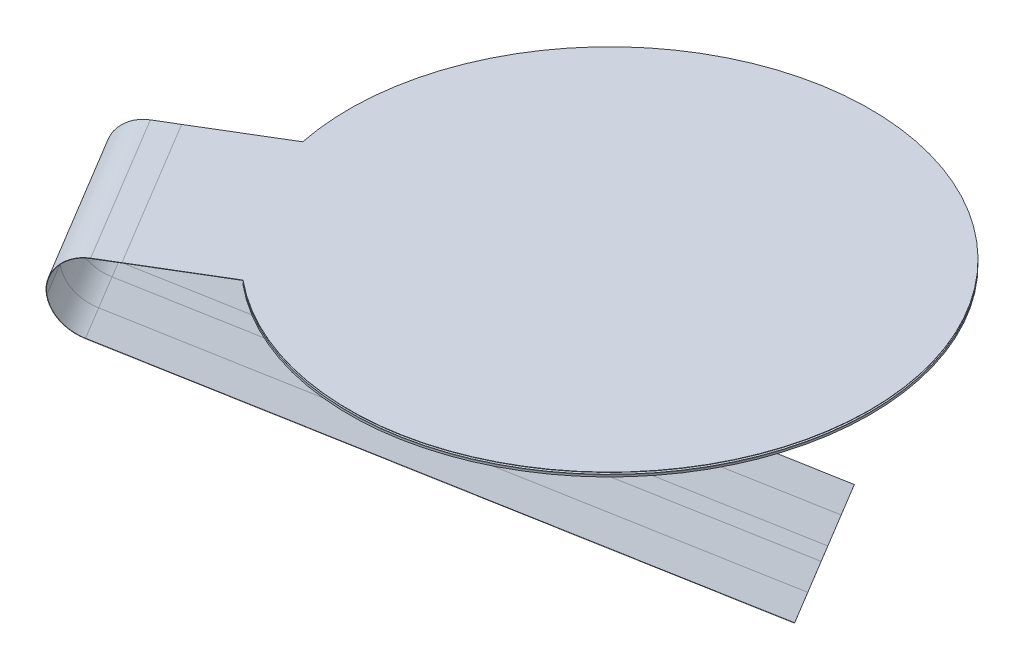
from build123d import *

# Parameters (mm, degrees)
PET_ALL_DEPTH           = 0.01
EXTRUDE_2_DEPTH         = 0.05
EXTRUDE_2_2_DEPTH       = 0.05
EXTRUDE_3_DEPTH         = 0.05
EXTRUDE_5_DEPTH         = 0.05
FSR_START               = -0.06
FSR_DEPTH               = 0.01
EXTRUDE_START           = -0.05
EXTRUDE_3763_DEPTH      = 0.01
EXTRUDE_START_2         = -0.01
EXTRUDE_4177_DEPTH      = 0.11
EXTRUDE_4177_2_DEPTH    = 0.11
PET_TOUCH_START         = -0.07
PET_TOUCH_DEPTH         = 0.05
CUT_EXTRUDE1_DEPTH      = 36.388876363
CUT_EXTRUDE1_DEPTH_BACK = 36.388876363
SKETCH2_W               = 25.467698382
SKETCH2_H               = 11.490233749
SWEEP4_START            = -2.68
SWEEP4_DEPTH            = 5.36


# Read off the part's stored shape, not the designer's step: Sweep4
with BuildPart() as part:
    # 草图1 → PET_all (new body)
    with BuildSketch(Plane(origin=(0, 0, 0), x_dir=(1, 0, 0), z_dir=(0, 1, 0))):
        with BuildLine():
            Line((-5.080806512, -6.179434051), (-26.906218882, -19.293464838))
            Line((-26.906218882, -19.293464838), (-29.666822964, -14.699048106))
            Line((-29.666822964, -14.699048106), (-7.841410594, -1.585017319))
            ThreePointArc((-7.841410594, -1.585017319), (6.857338406, 4.120304599), (-5.080806512, -6.179434051))
        make_face()
    extrude(amount=PET_ALL_DEPTH)


with BuildPart() as body_2:
    # 草图2 → 凸台-拉伸2 (new body)
    with BuildSketch(Plane(origin=(0, 0, 0), x_dir=(1, 0, 0), z_dir=(0, 1, 0))):
        with BuildLine():
            Line((-6.852556619, -2.367481316), (-29.059078036, -15.710505521))
            Line((-29.059078036, -15.710505521), (-28.441032346, -16.739106282))
            Line((-28.441032346, -16.739106282), (-6.020473703, -3.267475537))
            ThreePointArc((-6.020473703, -3.267475537), (-3.952951141, 5.594343328), (5.090542055, 4.583544654))
            Line((5.090542055, 4.583544654), (5.387799985, 4.851196896))
            ThreePointArc((5.387799985, 4.851196896), (-3.682893806, 6.244901378), (-6.852556619, -2.367481316))
        make_face()
    extrude(amount=-EXTRUDE_2_DEPTH)

    # 草图8 → 凸台-拉伸5 (add)
    with BuildSketch(Plane(origin=(0, 0, 0), x_dir=(1, 0, 0), z_dir=(0, 1, 0))):
        with BuildLine():
            Line((1.081454982, 6.892290407), (6.242295753, -1.696791))
            ThreePointArc((6.242295753, -1.696791), (6.20808283, -1.834011537), (6.070862293, -1.799798615))
            Line((6.070862293, -1.799798615), (0.910021522, 6.789282792))
            Line((0.910021522, 6.789282792), (1.081454982, 6.892290407))
        make_face()
        with BuildLine():
            Line((5.763896557, -2.648044658), (0.057038255, 6.849762524))
            Line((0.057038255, 6.849762524), (0.228471715, 6.952770139))
            Line((0.228471715, 6.952770139), (5.935330017, -2.545037043))
            ThreePointArc((5.935330017, -2.545037043), (5.901117095, -2.68225758), (5.763896557, -2.648044658))
        make_face()
        with BuildLine():
            Line((5.383870342, -3.374697643), (-0.735925728, 6.810353392))
            Line((-0.735925728, 6.810353392), (-0.564492268, 6.913361007))
            Line((-0.564492268, 6.913361007), (5.555303802, -3.271690028))
            ThreePointArc((5.555303802, -3.271690028), (5.521090879, -3.408910565), (5.383870342, -3.374697643))
        make_face()
        with BuildLine():
            Line((4.946475675, -4.005873492), (-1.479272302, 6.688367025))
            Line((-1.479272302, 6.688367025), (-1.307838842, 6.79137464))
            Line((-1.307838842, 6.79137464), (5.117909135, -3.902865877))
            ThreePointArc((5.117909135, -3.902865877), (5.083696212, -4.040086414), (4.946475675, -4.005873492))
        make_face()
        with BuildLine():
            Line((4.460485593, -4.556172989), (-2.179199966, 6.494119456))
            Line((-2.179199966, 6.494119456), (-2.007766505, 6.597127071))
            Line((-2.007766505, 6.597127071), (4.631919054, -4.453165374))
            ThreePointArc((4.631919054, -4.453165374), (4.597706131, -4.590385912), (4.460485593, -4.556172989))
        make_face()
        with BuildLine():
            Line((3.930995262, -5.034075912), (-2.839423406, 6.233792964))
            Line((-2.839423406, 6.233792964), (-2.667989946, 6.336800579))
            Line((-2.667989946, 6.336800579), (4.102428722, -4.931068297))
            ThreePointArc((4.102428722, -4.931068297), (4.068215799, -5.068288835), (3.930995262, -5.034075912))
        make_face()
        with BuildLine():
            Line((3.360799138, -5.444233021), (-3.461976024, 5.910771693))
            Line((-3.461976024, 5.910771693), (-3.290542564, 6.013779308))
            Line((-3.290542564, 6.013779308), (3.532232598, -5.341225406))
            ThreePointArc((3.532232598, -5.341225406), (3.498019675, -5.478445944), (3.360799138, -5.444233021))
        make_face()
        with BuildLine():
            Line((2.751005911, -5.788489484), (-4.05547466, 5.539396479))
            Line((-4.05547466, 5.539396479), (-3.8840412, 5.642404094))
            Line((-3.8840412, 5.642404094), (2.922439372, -5.685481869))
            ThreePointArc((2.922439372, -5.685481869), (2.888226449, -5.822702407), (2.751005911, -5.788489484))
        make_face()
        with BuildLine():
            Line((2.10125667, -6.066247971), (-4.6144792, 5.110613445))
            Line((-4.6144792, 5.110613445), (-4.443045739, 5.21362106))
            Line((-4.443045739, 5.21362106), (2.27269013, -5.963240356))
            ThreePointArc((2.27269013, -5.963240356), (2.238477207, -6.100460893), (2.10125667, -6.066247971))
        make_face()
        with BuildLine():
            Line((1.409655834, -6.274353709), (-5.134986189, 4.617759729))
            Line((-5.134986189, 4.617759729), (-4.963552728, 4.720767344))
            Line((-4.963552728, 4.720767344), (1.581089294, -6.171346094))
            ThreePointArc((1.581089294, -6.171346094), (1.546876372, -6.308566631), (1.409655834, -6.274353709))
        make_face()
        with BuildLine():
            Line((0.67238137, -6.406445764), (-5.614197127, 4.056177842))
            Line((-5.614197127, 4.056177842), (-5.442763667, 4.159185457))
            Line((-5.442763667, 4.159185457), (0.84381483, -6.303438149))
            ThreePointArc((0.84381483, -6.303438149), (0.809601908, -6.440658687), (0.67238137, -6.406445764))
        make_face()
        with BuildLine():
            Line((-0.117235037, -6.451426197), (-6.047308049, 3.417872646))
            Line((-6.047308049, 3.417872646), (-5.875874589, 3.520880261))
            Line((-5.875874589, 3.520880261), (0.054198423, -6.348418582))
            ThreePointArc((0.054198423, -6.348418582), (0.019985501, -6.48563912), (-0.117235037, -6.451426197))
        make_face()
        with BuildLine():
            Line((-0.839616424, -6.608304495), (-6.426348382, 2.689578877))
            Line((-6.426348382, 2.689578877), (-6.254914922, 2.792586492))
            Line((-6.254914922, 2.792586492), (-0.668182964, -6.50529688))
            ThreePointArc((-0.668182964, -6.50529688), (-0.702395887, -6.642517417), (-0.839616424, -6.608304495))
        make_face()
    extrude(amount=-EXTRUDE_5_DEPTH)


with BuildPart() as body_3:
    # 草图2 → Extrude 2 2 (new body)
    with BuildSketch(Plane(origin=(0, 0, 0), x_dir=(1, 0, 0), z_dir=(0, 1, 0))):
        with BuildLine():
            Line((-5.711450859, -3.781775918), (-28.132009501, -17.253406662))
            Line((-28.132009501, -17.253406662), (-27.513963811, -18.282007423))
            Line((-27.513963811, -18.282007423), (-5.307442394, -4.938983218))
            ThreePointArc((-5.307442394, -4.938983218), (3.784906729, -6.18360583), (6.812771501, 2.479646039))
            Line((6.812771501, 2.479646039), (6.436894452, 2.342837982))
            ThreePointArc((6.436894452, 2.342837982), (3.083713825, -6.1166338), (-5.711450859, -3.781775918))
        make_face()
    extrude(amount=-EXTRUDE_2_2_DEPTH)

    # 草图3 → 凸台-拉伸3 (add)
    with BuildSketch(Plane(origin=(0, 0, 0), x_dir=(1, 0, 0), z_dir=(0, 1, 0))):
        with BuildLine():
            Line((-1.047532484, -6.896751097), (-6.232195187, 1.731976662))
            ThreePointArc((-6.232195187, 1.731976662), (-6.197982264, 1.869197199), (-6.060761726, 1.834984277))
            Line((-6.060761726, 1.834984277), (-0.876099024, -6.793743482))
            Line((-0.876099024, -6.793743482), (-1.047532484, -6.896751097))
        make_face()
        with BuildLine():
            Line((-5.750570155, 2.677861627), (-0.025682248, -6.849951855))
            Line((-0.025682248, -6.849951855), (-0.197115708, -6.95295947))
            Line((-0.197115708, -6.95295947), (-5.922003615, 2.574854012))
            ThreePointArc((-5.922003615, 2.574854012), (-5.887790693, 2.71207455), (-5.750570155, 2.677861627))
        make_face()
        with BuildLine():
            Line((-5.368120909, 3.400482012), (0.76522713, -6.807123287))
            Line((0.76522713, -6.807123287), (0.59379367, -6.910130902))
            Line((0.59379367, -6.910130902), (-5.539554369, 3.297474397))
            ThreePointArc((-5.539554369, 3.297474397), (-5.505341446, 3.434694934), (-5.368120909, 3.400482012))
        make_face()
        with BuildLine():
            Line((-4.928735727, 4.028345087), (1.50681812, -6.682215138))
            Line((1.50681812, -6.682215138), (1.33538466, -6.785222753))
            Line((1.33538466, -6.785222753), (-5.100169187, 3.925337472))
            ThreePointArc((-5.100169187, 3.925337472), (-5.065956264, 4.062558009), (-4.928735727, 4.028345087))
        make_face()
        with BuildLine():
            Line((-4.441005328, 4.57574821), (2.205170969, -6.485346637))
            Line((2.205170969, -6.485346637), (2.033737509, -6.588354252))
            Line((2.033737509, -6.588354252), (-4.612438788, 4.472740595))
            ThreePointArc((-4.612438788, 4.472740595), (-4.578225865, 4.609961132), (-4.441005328, 4.57574821))
        make_face()
        with BuildLine():
            Line((-3.909918327, 5.05099383), (2.863924943, -6.222574541))
            Line((2.863924943, -6.222574541), (2.692491483, -6.325582156))
            Line((2.692491483, -6.325582156), (-4.081351788, 4.947986215))
            ThreePointArc((-4.081351788, 4.947986215), (-4.047138865, 5.085206753), (-3.909918327, 5.05099383))
        make_face()
        with BuildLine():
            Line((-3.33819658, 5.458611874), (3.485058462, -5.897191494))
            Line((3.485058462, -5.897191494), (3.313625002, -6.000199109))
            Line((3.313625002, -6.000199109), (-3.50963004, 5.355604259))
            ThreePointArc((-3.50963004, 5.355604259), (-3.475417117, 5.492824797), (-3.33819658, 5.458611874))
        make_face()
        with BuildLine():
            Line((-2.726890579, 5.800350659), (4.077548538, -5.524137753))
            Line((4.077548538, -5.524137753), (3.906115078, -5.627145368))
            Line((3.906115078, -5.627145368), (-2.89832404, 5.697343044))
            ThreePointArc((-2.89832404, 5.697343044), (-2.864111117, 5.834563582), (-2.726890579, 5.800350659))
        make_face()
        with BuildLine():
            Line((-2.075585665, 6.075520072), (4.635113229, -5.092958409))
            Line((4.635113229, -5.092958409), (4.463679769, -5.195966024))
            Line((4.463679769, -5.195966024), (-2.247019125, 5.972512457))
            ThreePointArc((-2.247019125, 5.972512457), (-2.212806203, 6.109732995), (-2.075585665, 6.075520072))
        make_face()
        with BuildLine():
            Line((-1.382322156, 6.280858656), (5.154102372, -4.597578573))
            Line((5.154102372, -4.597578573), (4.982668912, -4.700586188))
            Line((4.982668912, -4.700586188), (-1.553755616, 6.177851041))
            ThreePointArc((-1.553755616, 6.177851041), (-1.519542693, 6.315071579), (-1.382322156, 6.280858656))
        make_face()
        with BuildLine():
            Line((-0.643190633, 6.409860046), (5.631653498, -4.033234295))
            Line((5.631653498, -4.033234295), (5.460220038, -4.13624191))
            Line((5.460220038, -4.13624191), (-0.814624093, 6.306852431))
            ThreePointArc((-0.814624093, 6.306852431), (-0.78041117, 6.444072969), (-0.643190633, 6.409860046))
        make_face()
        with BuildLine():
            Line((0.148616374, 6.451194709), (6.062868343, -3.391773497))
            Line((6.062868343, -3.391773497), (5.891434883, -3.494781112))
            Line((5.891434883, -3.494781112), (-0.022817086, 6.348187094))
            ThreePointArc((-0.022817086, 6.348187094), (0.011395837, 6.485407632), (0.148616374, 6.451194709))
        make_face()
        with BuildLine():
            Line((0.873233676, 6.604351819), (6.439617509, -2.659666584))
            Line((6.439617509, -2.659666584), (6.268184049, -2.762674199))
            Line((6.268184049, -2.762674199), (0.701800216, 6.501344204))
            ThreePointArc((0.701800216, 6.501344204), (0.736013139, 6.638564741), (0.873233676, 6.604351819))
        make_face()
    extrude(amount=-EXTRUDE_3_DEPTH)


with BuildPart() as body_4:
    # 草图6 → FSR (new body)
    with BuildSketch(Plane(origin=(0, 0, 0), x_dir=(1, 0, 0), z_dir=(0, 1, 0)).offset(FSR_START)):
        with BuildLine():
            Line((-7.841410594, -1.585017319), (-6.73759767, -0.921779602))
            Line((-6.73759767, -0.921779602), (-3.976993589, -5.516196334))
            Line((-3.976993589, -5.516196334), (-5.080806512, -6.179434051))
            ThreePointArc((-5.080806512, -6.179434051), (6.857338406, 4.120304599), (-7.841410594, -1.585017319))
        make_face()
    extrude(amount=-FSR_DEPTH)


with BuildPart() as body_5:
    # 草图10 → Extrude 3763 (new body)
    with BuildSketch(Plane(origin=(0, 0, 0), x_dir=(1, 0, 0), z_dir=(0, 1, 0)).offset(EXTRUDE_START)):
        with BuildLine():
            Line((-7.841410594, -1.585017319), (-6.73759767, -0.921779602))
            Line((-6.73759767, -0.921779602), (-5.460303244, -3.047554508))
            Line((-5.460303244, -3.047554508), (-3.956448953, -2.143947687))
            ThreePointArc((-3.956448953, -2.143947687), (3.857252853, 2.317671337), (-3.750433723, -2.486814608))
            Line((-3.750433723, -2.486814608), (-5.254288014, -3.390421428))
            Line((-5.254288014, -3.390421428), (-3.976993589, -5.516196334))
            Line((-3.976993589, -5.516196334), (-5.080806512, -6.179434051))
            ThreePointArc((-5.080806512, -6.179434051), (6.857338406, 4.120304599), (-7.841410594, -1.585017319))
        make_face()
    extrude(amount=-EXTRUDE_3763_DEPTH)


with BuildPart() as body_6:
    # 草图11 → Extrude 4177 (new body)
    with BuildSketch(Plane(origin=(0, 0, 0), x_dir=(1, 0, 0), z_dir=(0, 1, 0)).offset(EXTRUDE_START_2)):
        Polygon((-6.181356549, -1.847520287), (-5.460303244, -3.047554508), (-28.389528538, -16.824823012), (-29.110581843, -15.624788791), align=None)
    extrude(amount=-EXTRUDE_4177_DEPTH)


with BuildPart() as body_7:
    # 草图11 → Extrude 4177 2 (new body)
    with BuildSketch(Plane(origin=(0, 0, 0), x_dir=(1, 0, 0), z_dir=(0, 1, 0)).offset(EXTRUDE_START_2)):
        Polygon((-5.254288014, -3.390421428), (-28.183513308, -17.167689932), (-27.462460003, -18.367724153), (-4.53323471, -4.590455649), align=None)
    extrude(amount=-EXTRUDE_4177_2_DEPTH)


with BuildPart() as body_8:
    # 草图12 → PET_touch (new body)
    with BuildSketch(Plane(origin=(0, 0, 0), x_dir=(1, 0, 0), z_dir=(0, 1, 0)).offset(PET_TOUCH_START)):
        with BuildLine():
            Line((-3.976993589, -5.516196334), (-5.080806512, -6.179434051))
            ThreePointArc((-5.080806512, -6.179434051), (6.857338406, 4.120304599), (-7.841410594, -1.585017319))
            Line((-7.841410594, -1.585017319), (-6.73759767, -0.921779602))
            Line((-6.73759767, -0.921779602), (-3.976993589, -5.516196334))
        make_face()
    extrude(amount=-PET_TOUCH_DEPTH)


with BuildPart() as cut_extrude1_tool:
    # Sketch2 → Cut-Extrude1 (new, two sides: drawn at the far end of the back side and taken through both)
    with BuildSketch(Plane(origin=(0, 0, 0), x_dir=(0.8571673007021138, 0, -0.5150380749100519), z_dir=(-0.5150380749100519, 0, -0.8571673007021138)).offset(-CUT_EXTRUDE1_DEPTH_BACK)):
        with Locations((-22.980947337, -1.132725722)):
            Rectangle(SKETCH2_W, SKETCH2_H)
    extrude(amount=CUT_EXTRUDE1_DEPTH + CUT_EXTRUDE1_DEPTH_BACK)


with BuildPart() as part_1:
    add(part.part)

    # Cut-Extrude1: cut by cut_extrude1_tool
    add(cut_extrude1_tool.part, mode=Mode.SUBTRACT)


with BuildPart() as body_2_1:
    add(body_2.part)

    # Cut-Extrude1: cut by cut_extrude1_tool
    add(cut_extrude1_tool.part, mode=Mode.SUBTRACT)


with BuildPart() as body_3_1:
    add(body_3.part)

    # Cut-Extrude1: cut by cut_extrude1_tool
    add(cut_extrude1_tool.part, mode=Mode.SUBTRACT)


with BuildPart() as body_6_1:
    add(body_6.part)

    # Cut-Extrude1: cut by cut_extrude1_tool
    add(cut_extrude1_tool.part, mode=Mode.SUBTRACT)


with BuildPart() as body_7_1:
    add(body_7.part)

    # Cut-Extrude1: cut by cut_extrude1_tool
    add(cut_extrude1_tool.part, mode=Mode.SUBTRACT)


with BuildPart() as body_9:
    # Sweep4 outline → Sweep4 (new body)
    with BuildSketch(Plane(origin=(0, 0, 0), x_dir=(0.8571673007021137, 0, -0.5150380749100519), z_dir=(0.5150380749100519, 0, 0.8571673007021138)).offset(SWEEP4_START)):
        with BuildLine():
            Line((-11.064952349, -2.150897964), (4.805773397, -7.003065762))
            Line((4.805773397, -7.003065762), (4.808697114, -6.993502714))
            Line((4.808697114, -6.993502714), (-11.062028632, -2.141334917))
            ThreePointArc((-11.062028632, -2.141334917), (-11.642895568, -1.760241587), (-11.927635441, -1.126552603))
            ThreePointArc((-11.927635441, -1.126552603), (-11.693853487, -0.340033492), (-10.947098146, 0))
            Line((-10.947098146, 0), (-10.247098146, 0))
            Line((-10.247098146, 0), (-10.247098146, 0.01))
            Line((-10.247098146, 0.01), (-10.947098146, 0.01))
            ThreePointArc((-10.947098146, 0.01), (-11.70139647, -0.333468174), (-11.937539858, -1.127931923))
            ThreePointArc((-11.937539858, -1.127931923), (-11.650503696, -1.766731301), (-11.064952349, -2.150897964))
        make_face()
    extrude(amount=SWEEP4_DEPTH)


solid = Compound([body_4.part, body_5.part, body_8.part, part_1.part, body_2_1.part, body_3_1.part, body_6_1.part, body_7_1.part, body_9.part])
